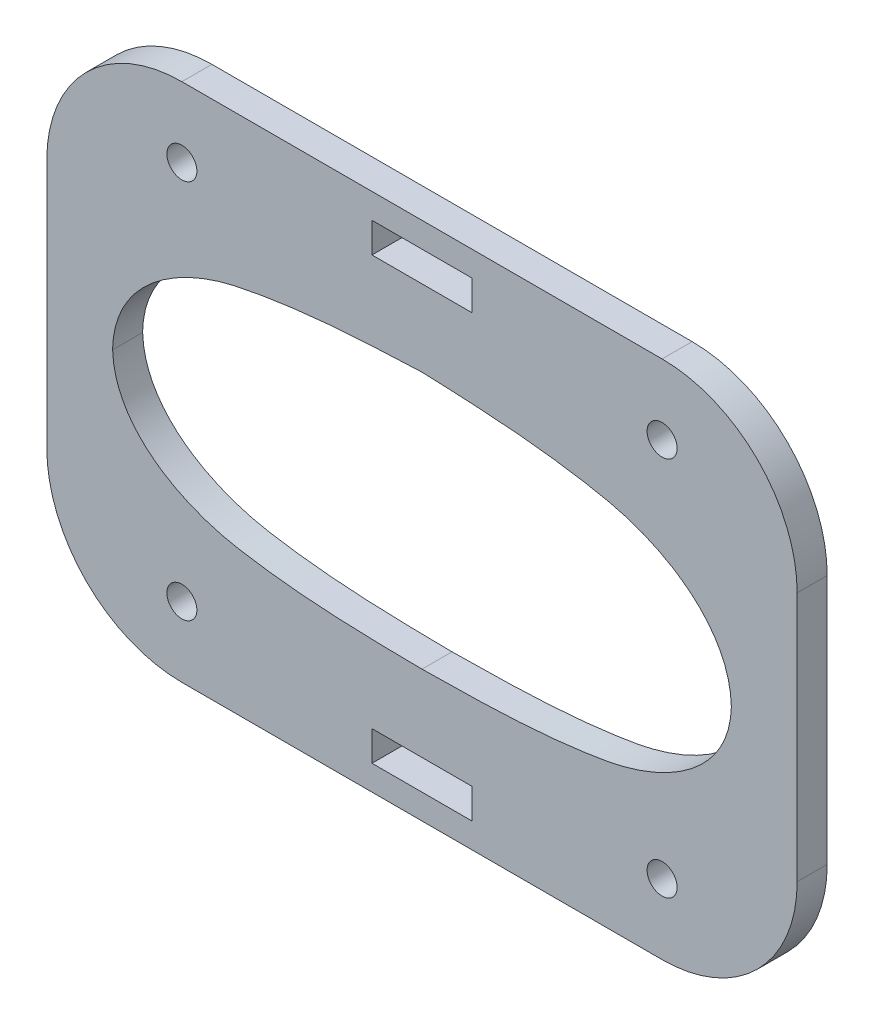
from build123d import *

# Parameters (mm, degrees)
ESBO_O1_R                = 1.5
ESBO_O1_W                = 10
ESBO_O1_H                = 3
RESSALTO_EXTRUS_O1_DEPTH = 3


with BuildPart() as part:
    # Esboço1 → Ressalto-extrusão1 (new body)
    with BuildSketch(Plane.XY):
        with BuildLine():
            Line((24, 26.67462883), (-24, 26.67462883))
            ThreePointArc((-24, 26.67462883), (-33.545941546, 22.720570376), (-37.5, 13.17462883))
            Line((-37.5, 13.17462883), (-37.5, -11.82537117))
            ThreePointArc((-37.5, -11.82537117), (-33.545941546, -21.371312716), (-24, -25.32537117))
            Line((-24, -25.32537117), (24, -25.32537117))
            ThreePointArc((24, -25.32537117), (33.545941546, -21.371312716), (37.5, -11.82537117))
            Line((37.5, -11.82537117), (37.5, 13.17462883))
            ThreePointArc((37.5, 13.17462883), (33.545941546, 22.720570376), (24, 26.67462883))
        make_face()
        with Locations((24, -18.32537117)):
            Circle(ESBO_O1_R, mode=Mode.SUBTRACT)
        with Locations((-24, -18.32537117)):
            Circle(ESBO_O1_R, mode=Mode.SUBTRACT)
        with Locations((24, 19.67462883)):
            Circle(ESBO_O1_R, mode=Mode.SUBTRACT)
        with Locations((-24, 19.67462883)):
            Circle(ESBO_O1_R, mode=Mode.SUBTRACT)
        with Locations((0, -21.32537117)):
            Rectangle(ESBO_O1_W, ESBO_O1_H, mode=Mode.SUBTRACT)
        with Locations((0, 22.67462883)):
            Rectangle(ESBO_O1_W, ESBO_O1_H, mode=Mode.SUBTRACT)
        with BuildLine():
            add(Edge.make_bspline(
                [(0, 13.52800581), (-6.244479207, 13.288234114), (-12.519024876, 12.967406591), (-24.729426481, 10.351573244), (-30.828882804, 6.291678687), (-30.923326902, 0)],
                knots=[0, 0, 0, 0, 0.5, 0.5, 1, 1, 1, 1], degree=3))
            add(Edge.make_bspline(
                [(-30.923326902, 0), (-30.740150744, -6.181351573), (-24.460961859, -9.854903261), (-12.334591232, -11.984454717), (-6.155571444, -12.112058494), (0, -12.17874815)],
                knots=[0, 0, 0, 0, 0.5, 0.5, 1, 1, 1, 1], degree=3))
            add(Edge.make_bspline(
                [(30.923326902, 0), (30.740150744, -6.181351573), (24.460961859, -9.854903261), (12.334591232, -11.984454717), (6.155571444, -12.112058494), (0, -12.17874815)],
                knots=[0, 0, 0, 0, 0.5, 0.5, 1, 1, 1, 1], degree=3))
            add(Edge.make_bspline(
                [(0, 13.52800581), (6.244479207, 13.288234114), (12.519024876, 12.967406591), (24.729426481, 10.351573244), (30.828882804, 6.291678687), (30.923326902, 0)],
                knots=[0, 0, 0, 0, 0.5, 0.5, 1, 1, 1, 1], degree=3))
        make_face(mode=Mode.SUBTRACT)
    extrude(amount=RESSALTO_EXTRUS_O1_DEPTH)


solid = part.part
